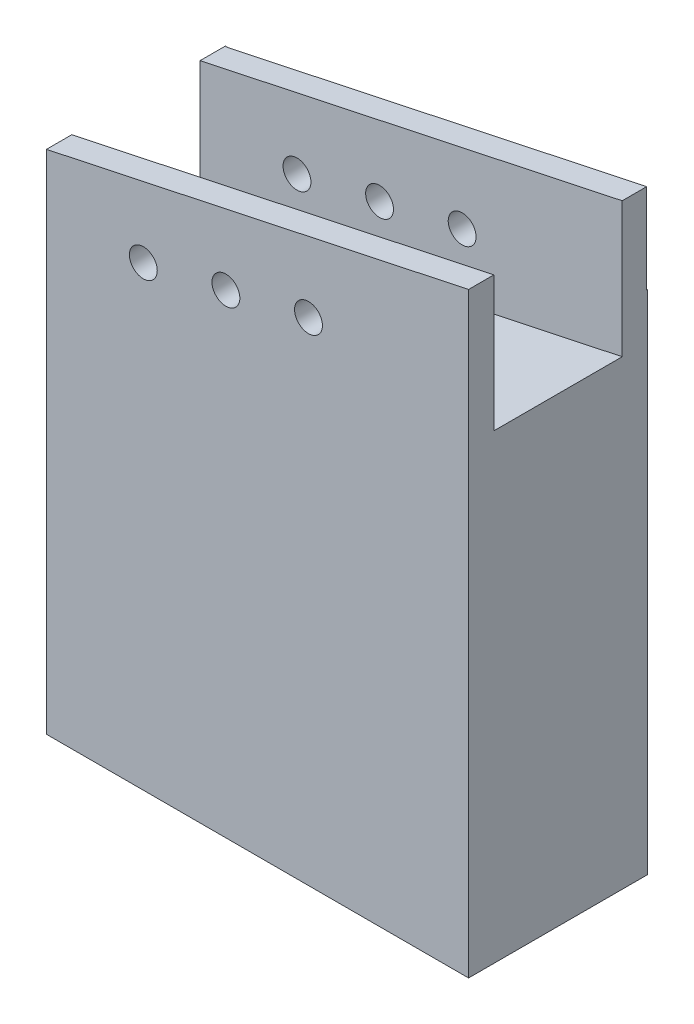
from build123d import *

# Parameters (mm, degrees)
SKETCH_1_W          = 50
SKETCH_1_H          = 60
EXTRUDE_1_DEPTH     = 10.6
EXTRUDE_2_DEPTH     = 3
EXTRUDE_START       = -18.1
EXTRUDE_3_DEPTH     = 3
SKETCH_3_W          = 15.2
SKETCH_3_H          = 16
SKETCH_4_R          = 1.65
CUT_EXTRUDE_1_DEPTH = 3


with BuildPart() as part:
    # 草图1 → 凸台-拉伸1 (new, symmetric)
    with BuildSketch(Plane.XY):
        Rectangle(SKETCH_1_W, SKETCH_1_H)
    extrude(amount=EXTRUDE_1_DEPTH, both=True)

    # 草图2 → 凸台-拉伸2 (add)
    with BuildSketch(Plane.XY.offset(10.6)):
        Polygon((-25, 30), (25, 40.627828084), (25, 30), align=None)
    extrude(amount=-EXTRUDE_2_DEPTH)

    # 草图2<2> → 凸台-拉伸3 (add)
    with BuildSketch(Plane.XY.offset(10.6).offset(EXTRUDE_START)):
        Polygon((-25, 30), (25, 40.627828084), (25, 30), align=None)
    extrude(amount=-EXTRUDE_3_DEPTH)

    # 切除-扫描1: sweep along a curve in space
    with BuildLine() as sweep_1_path:
        Line((25, 40.627828084, 10.6), (-25, 30, 10.6))
    # 草图3 → 切除-扫描1 (sweep, cut)
    with BuildSketch(Plane.ZY.offset(25)):
        with Locations((0, 22)):
            Rectangle(SKETCH_3_W, SKETCH_3_H)
    sweep(path=sweep_1_path.line, mode=Mode.SUBTRACT)

    # 草图4 → 切除-拉伸1 (cut)
    with BuildSketch(Plane.XY.offset(-7.6)):
        with Locations((-13.523968529, 24.106860253)):
            Circle(SKETCH_4_R)
        with Locations((-3.742492522, 26.185977161)):
            Circle(SKETCH_4_R)
        with Locations((6.038983485, 28.265094069)):
            Circle(SKETCH_4_R)
    cut_extrude_1 = extrude(amount=-CUT_EXTRUDE_1_DEPTH, mode=Mode.SUBTRACT)

    # 镜向1: 切除-拉伸1 across plane
    add(cut_extrude_1.mirror(Plane.XY), mode=Mode.SUBTRACT)


solid = part.part
